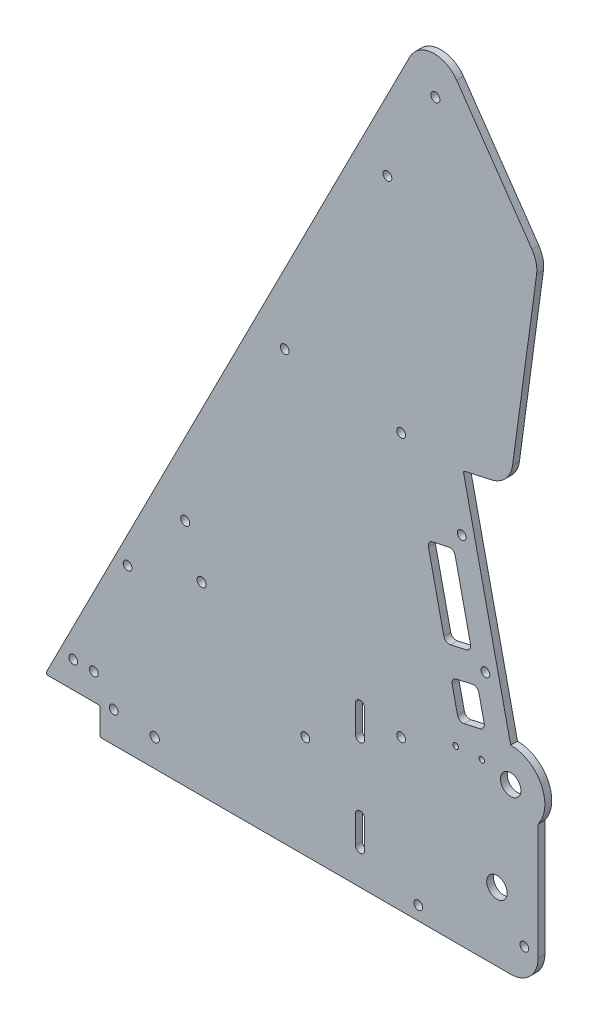
from build123d import *

# Parameters (mm, degrees)
BOSS_EXTRUDE1_DEPTH     = 3.175
SKETCH2_R               = 2.0955
SKETCH2_R_2             = 2.032
SKETCH2_R_3             = 4.7625
CUT_EXTRUDE1_DEPTH      = 421.976111717
SKETCH7_R               = 2.159
CUT_EXTRUDE2_DEPTH      = 421.976111717
CUT_EXTRUDE3_REACH      = 422.976
SKETCH10_R              = 2.032
FILLET1_R               = 12.7
FILLET2_R               = 0.79375
SKETCH12_R              = 2.032
CUT_EXTRUDE5_DEPTH      = 411.989226146
CUT_EXTRUDE6_DEPTH      = 411.989226146
CUT_EXTRUDE6_DEPTH_BACK = 411.989226146
SKETCH13_R              = 1.27
CUT_EXTRUDE7_REACH      = 412.989
SKETCH14_R              = 2.032
FILLET3_R               = 2.54


with BuildPart() as part:
    # Sketch1 → Boss-Extrude1 (new body)
    with BuildSketch(Plane.XY):
        with BuildLine():
            Line((228.6, -12.7), (228.6, 53.975))
            ThreePointArc((228.6, 53.975), (230.099031657, 70.599515829), (215.9, 79.375))
            Line((215.9, 79.375), (193.909735224, 178.566674323))
            Line((193.909735224, 178.566674323), (215.607913982, 183.377044743))
            Line((215.607913982, 183.377044743), (228.6, 279.4))
            Line((228.6, 279.4), (178.754725958, 351.413083686))
            Line((178.754725958, 351.413083686), (0, 0))
            Line((0, 0), (25.4, 0))
            Line((25.4, 0), (25.4, -12.7))
            Line((25.4, -12.7), (228.6, -12.7))
        make_face()
    extrude(amount=BOSS_EXTRUDE1_DEPTH)

    # Sketch2 → Cut-Extrude1 (cut, through all)
    with BuildSketch(Plane.XY.offset(3.175)):
        with Locations((64.943150167, 94.057839899)):
            Circle(SKETCH2_R)
        with Locations((180.975, 322.164313376)):
            Circle(SKETCH2_R)
        with Locations((72.544547852, 73.173171402)):
            Circle(SKETCH2_R)
        with Locations((193.207821773, 152.394364194)):
            Circle(SKETCH2_R_2)
        with Locations((215.9, 63.5)):
            Circle(SKETCH2_R_3)
        with Locations((173.0375, -6.35)):
            Circle(SKETCH2_R_2)
        with Locations((204.202954161, 102.798527032)):
            Circle(SKETCH2_R_2)
        with Locations((209.55, 19.05)):
            Circle(SKETCH2_R_3)
        with Locations((165.1, 179.3875)):
            Circle(SKETCH2_R_2)
    extrude(amount=-CUT_EXTRUDE1_DEPTH, mode=Mode.SUBTRACT)

    # Sketch7 → Cut-Extrude2 (cut, through all)
    with BuildSketch(Plane.XY.offset(3.175)):
        with Locations((50.8, 0)):
            Circle(SKETCH7_R)
        with BuildLine():
            Line((143.891, 3.175), (143.891, 15.875))
            ThreePointArc((143.891, 15.875), (146.05, 18.034), (148.209, 15.875))
            Line((148.209, 15.875), (148.209, 3.175))
            ThreePointArc((148.209, 3.175), (146.05, 1.016), (143.891, 3.175))
        make_face()
        with BuildLine():
            Line((143.891, 47.625), (143.891, 60.325))
            ThreePointArc((143.891, 60.325), (146.05, 62.484), (148.209, 60.325))
            Line((148.209, 60.325), (148.209, 47.625))
            ThreePointArc((148.209, 47.625), (146.05, 45.466), (143.891, 47.625))
        make_face()
    extrude(amount=-CUT_EXTRUDE2_DEPTH, mode=Mode.SUBTRACT)

    # Sketch10 → Cut-Extrude3 (cut, up to next)
    with BuildSketch(Plane.XY.offset(3.175), mode=Mode.PRIVATE) as cut_extrude3_sk1:
        with Locations((165.1, 57.15)):
            Circle(SKETCH10_R)
    cut_extrude3_tool1 = extrude(cut_extrude3_sk1.sketch, amount=-CUT_EXTRUDE3_REACH, mode=Mode.PRIVATE) & part.part
    # Sketch10 → Cut-Extrude3 (cut, up to next)
    with BuildSketch(Plane.XY.offset(3.175), mode=Mode.PRIVATE) as cut_extrude3_sk2:
        with Locations((120.65, 34.925)):
            Circle(SKETCH10_R)
    cut_extrude3_tool2 = extrude(cut_extrude3_sk2.sketch, amount=-CUT_EXTRUDE3_REACH, mode=Mode.PRIVATE) & part.part
    # Sketch10 → Cut-Extrude3 (cut, up to next)
    with BuildSketch(Plane.XY.offset(3.175), mode=Mode.PRIVATE) as cut_extrude3_sk3:
        with Locations((13.046467246, 12.334704411)):
            Circle(SKETCH10_R)
    cut_extrude3_tool3 = extrude(cut_extrude3_sk3.sketch, amount=-CUT_EXTRUDE3_REACH, mode=Mode.PRIVATE) & part.part
    # Sketch10 → Cut-Extrude3 (cut, up to next)
    with BuildSketch(Plane.XY.offset(3.175), mode=Mode.PRIVATE) as cut_extrude3_sk4:
        with Locations((22.571467246, 12.334704411)):
            Circle(SKETCH10_R)
    cut_extrude3_tool4 = extrude(cut_extrude3_sk4.sketch, amount=-CUT_EXTRUDE3_REACH, mode=Mode.PRIVATE) & part.part
    # Sketch10 → Cut-Extrude3 (cut, up to next)
    with BuildSketch(Plane.XY.offset(3.175), mode=Mode.PRIVATE) as cut_extrude3_sk5:
        with Locations((38.211447917, 62.639810909)):
            Circle(SKETCH10_R)
    cut_extrude3_tool5 = extrude(cut_extrude3_sk5.sketch, amount=-CUT_EXTRUDE3_REACH, mode=Mode.PRIVATE) & part.part
    add(cut_extrude3_tool1.solids().sort_by_distance((165.1, 57.15, 3.175))[0], mode=Mode.SUBTRACT)
    add(cut_extrude3_tool2.solids().sort_by_distance((120.65, 34.925, 3.175))[0], mode=Mode.SUBTRACT)
    add(cut_extrude3_tool3.solids().sort_by_distance((13.046467, 12.334704, 3.175))[0], mode=Mode.SUBTRACT)
    add(cut_extrude3_tool4.solids().sort_by_distance((22.571467, 12.334704, 3.175))[0], mode=Mode.SUBTRACT)
    add(cut_extrude3_tool5.solids().sort_by_distance((38.211448, 62.639811, 3.175))[0], mode=Mode.SUBTRACT)

    # Fillet1
    fillet1_edges = [part.edges().sort_by_distance(p)[0] for p in [
        (228.6, -12.7, 1.5875),
        (178.754725958, 351.413083686, 1.5875),
        (215.607913982, 183.377044743, 1.5875),
        (228.6, 279.4, 1.5875),
    ]]
    fillet(fillet1_edges, radius=FILLET1_R)

    # Fillet2
    fillet2_edges = [part.edges().sort_by_distance(p)[0] for p in [
        (25.4, -12.7, 1.5875),
        (25.4, 0, 1.5875),
        (193.909735224, 178.566674323, 1.5875),
        (0, 0, 1.5875),
    ]]
    fillet(fillet2_edges, radius=FILLET2_R)

    # Sketch12 → Cut-Extrude5 (cut, through all)
    with BuildSketch(Plane.XY.offset(3.175)):
        with Locations((31.75, 1.5875)):
            Circle(SKETCH12_R)
        with Locations((222.25, 1.5875)):
            Circle(SKETCH12_R)
    extrude(amount=-CUT_EXTRUDE5_DEPTH, mode=Mode.SUBTRACT)

    # Sketch13 → Cut-Extrude6 (cut, two sides: drawn at the far end of the back side and taken through both)
    with BuildSketch(Plane.XY.offset(3.175).offset(-CUT_EXTRUDE6_DEPTH_BACK)):
        with Locations((190.426832263, 66.260948917)):
            Circle(SKETCH13_R)
        with Locations((202.533497378, 66.789537331)):
            Circle(SKETCH13_R)
        Polygon((189.622629605, 145.09537131), (197.868978896, 107.898493439), (185.470019606, 105.149710342), (177.223670315, 142.346588213), align=None)
        Polygon((188.218802703, 92.750751051), (200.617761993, 95.499534148), (204.191180019, 79.380887071), (191.792220729, 76.632103974), align=None)
    extrude(amount=CUT_EXTRUDE6_DEPTH + CUT_EXTRUDE6_DEPTH_BACK, mode=Mode.SUBTRACT)

    # Sketch14 → Cut-Extrude7 (cut, up to next)
    with BuildSketch(Plane.XY.offset(3.175), mode=Mode.PRIVATE) as cut_extrude7_sk1:
        with Locations((158.75, 279.4)):
            Circle(SKETCH14_R)
    cut_extrude7_tool1 = extrude(cut_extrude7_sk1.sketch, amount=-CUT_EXTRUDE7_REACH, mode=Mode.PRIVATE) & part.part
    # Sketch14 → Cut-Extrude7 (cut, up to next)
    with BuildSketch(Plane.XY.offset(3.175), mode=Mode.PRIVATE) as cut_extrude7_sk2:
        with Locations((111.125, 186.055)):
            Circle(SKETCH14_R)
    cut_extrude7_tool2 = extrude(cut_extrude7_sk2.sketch, amount=-CUT_EXTRUDE7_REACH, mode=Mode.PRIVATE) & part.part
    add(cut_extrude7_tool1.solids().sort_by_distance((158.75, 279.4, 3.175))[0], mode=Mode.SUBTRACT)
    add(cut_extrude7_tool2.solids().sort_by_distance((111.125, 186.055, 3.175))[0], mode=Mode.SUBTRACT)

    # Fillet3
    fillet3_edges = [part.edges().sort_by_distance(p)[0] for p in [
        (177.223670315, 142.346588213, 1.5875),
        (189.622629605, 145.09537131, 1.5875),
        (197.868978896, 107.898493439, 1.5875),
        (185.470019606, 105.149710342, 1.5875),
        (200.617761993, 95.499534148, 1.5875),
        (188.218802703, 92.750751051, 1.5875),
        (191.792220729, 76.632103974, 1.5875),
        (204.191180019, 79.380887071, 1.5875),
    ]]
    fillet(fillet3_edges, radius=FILLET3_R)


solid = part.part
